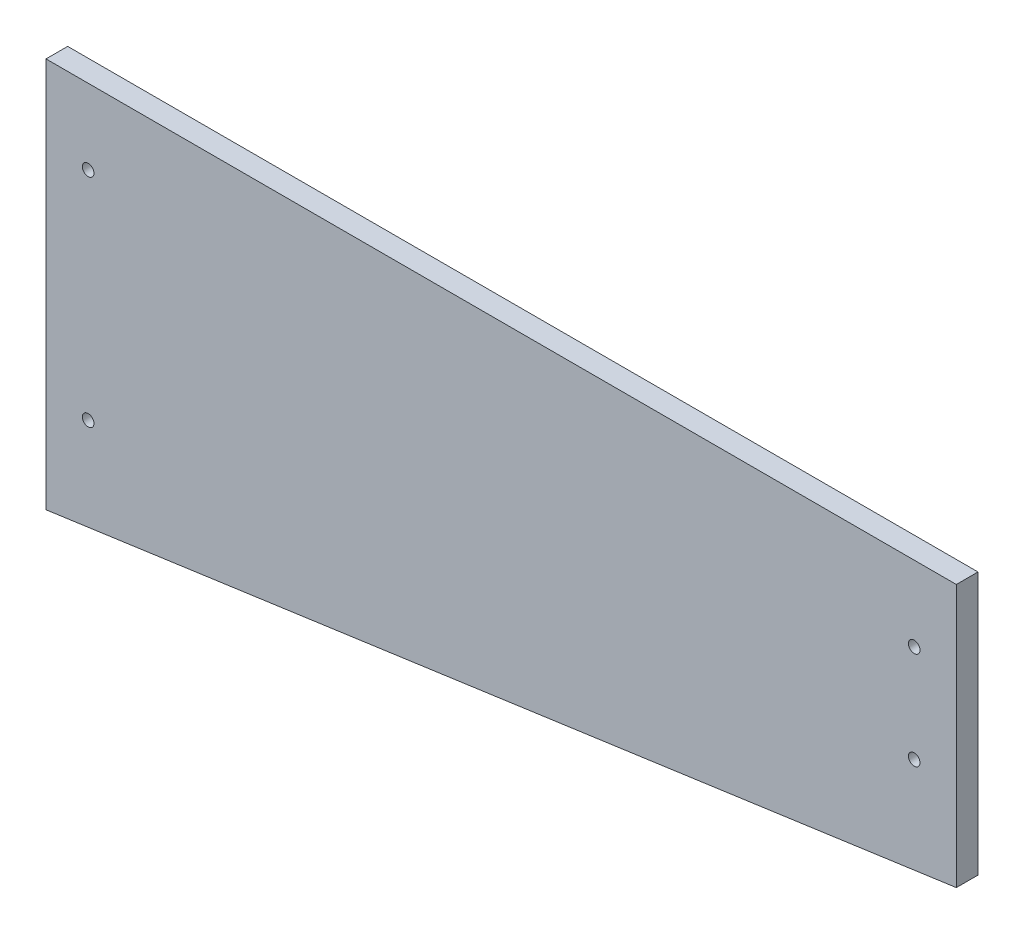
from build123d import *

# Parameters (mm, degrees)
SKETCH1_W            = 266.7
SKETCH1_H            = 114.4016
BOSS_EXTRUDE1_DEPTH  = 6.35
M3_CLEARANCE_HOLE1_D = 3.4
CUT_EXTRUDE2_DEPTH   = 291.270457647


with BuildPart() as part:
    # Sketch1 → Boss-Extrude1 (new body)
    with BuildSketch(Plane.XY):
        with Locations((133.35, 57.2008)):
            Rectangle(SKETCH1_W, SKETCH1_H)
    extrude(amount=BOSS_EXTRUDE1_DEPTH)

    # M3 Clearance Hole1 (through all)
    with Locations(Plane.XY.offset(6.35)):
        with Locations((12.3444, 92.4052), (12.3444, 28.9052), (254.3556, 63.8302), (254.3556, 92.4052)):
            Hole(M3_CLEARANCE_HOLE1_D / 2)

    # Sketch5 → Cut-Extrude2 (cut, through all)
    with BuildSketch(Plane.XY.offset(6.35)):
        Polygon((0, 0), (266.7, 0), (266.7, 37.482240615), align=None)
    extrude(amount=-CUT_EXTRUDE2_DEPTH, mode=Mode.SUBTRACT)


solid = part.part
